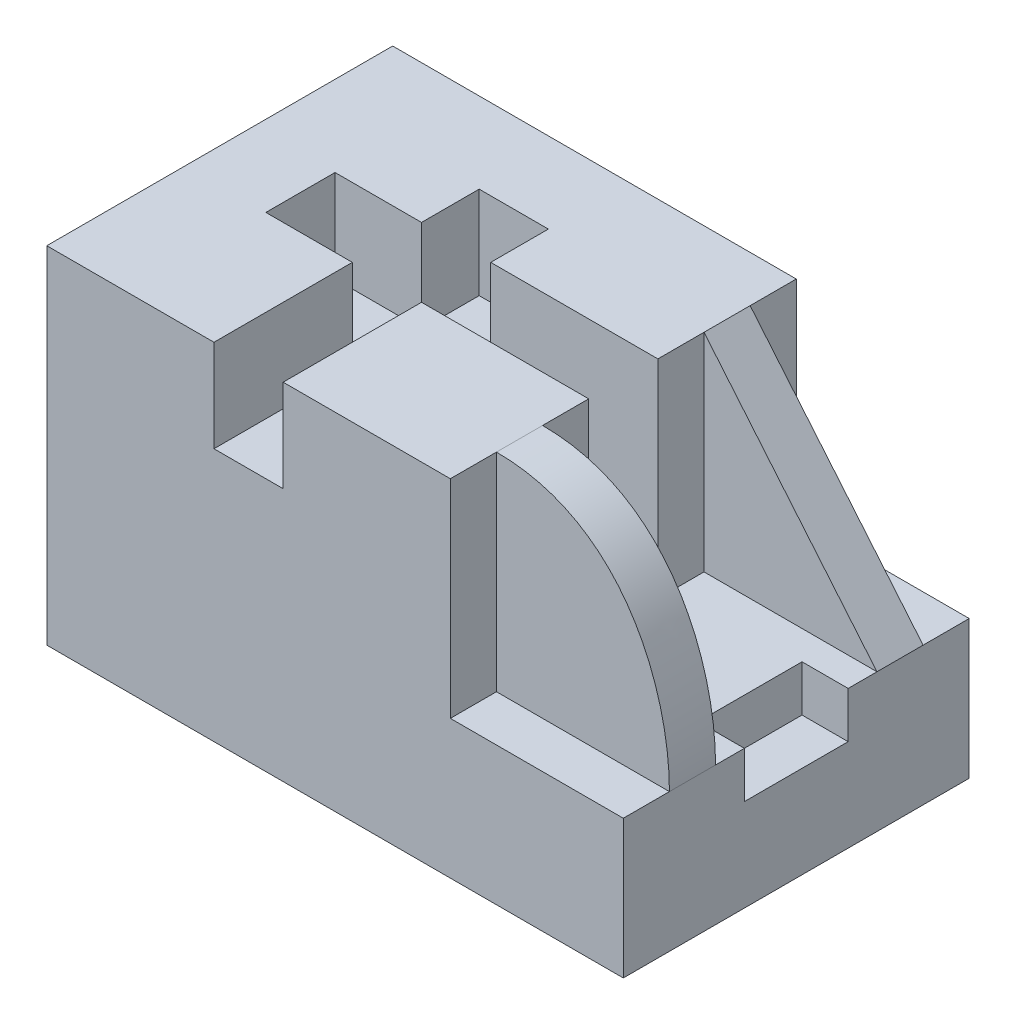
from build123d import *

# Parameters (mm, degrees)
SKETCH_1_W          = 50
SKETCH_1_H          = 30
EXTRUDE_1_DEPTH     = 30
SKETCH_2_W          = 15
SKETCH_2_H          = 18
CUT_EXTRUDE_1_DEPTH = 42.833001327
SKETCH_3_W          = 14.5
SKETCH_3_H          = 6
CUT_EXTRUDE_2_DEPTH = 18
SKETCH_3_3_W        = 6
SKETCH_3_3_H        = 12
SKETCH_3_3_H_2      = 6
SKETCH_3_3_H_3      = 5
SKETCH_3_3_W_2      = 7.5
CUT_EXTRUDE_3_DEPTH = 8
RIB_START           = -2
RIB_1_DEPTH         = 4
RIB_2_REACH         = 39.762
SKETCH_5_WALL_W     = 100.955579594
SKETCH_5_WALL_H     = 4
SKETCH_6_W          = 4
SKETCH_6_H          = 9
CUT_EXTRUDE_4_DEPTH = 4


# Read off the part's stored shape, not the designer's step: Ребро1
with BuildPart() as part:
    # Эскиз1 → Бобышка-Вытянуть1 (new body)
    with BuildSketch(Plane.XY):
        Rectangle(SKETCH_1_W, SKETCH_1_H)
    extrude(amount=EXTRUDE_1_DEPTH)

    # Эскиз2 → Вырез-Вытянуть1 (cut, through all)
    with BuildSketch(Plane.XY.offset(30)):
        with Locations((17.5, 6)):
            Rectangle(SKETCH_2_W, SKETCH_2_H)
    extrude(amount=-CUT_EXTRUDE_1_DEPTH, mode=Mode.SUBTRACT)

    # Эскиз3 → Вырез-Вытянуть2 (cut)
    with BuildSketch(Plane(origin=(0, 15, 0), x_dir=(1, 0, 0), z_dir=(0, 1, 0))):
        with Locations((2.75, -15)):
            Rectangle(SKETCH_3_W, SKETCH_3_H)
    extrude(amount=-CUT_EXTRUDE_2_DEPTH, mode=Mode.SUBTRACT)

    # Эскиз3<3> → Вырез-Вытянуть3 (cut)
    with BuildSketch(Plane(origin=(0, 15, 0), x_dir=(1, 0, 0), z_dir=(0, 1, 0))):
        with Locations((-7.5, -24)):
            Rectangle(SKETCH_3_3_W, SKETCH_3_3_H)
        with Locations((-7.5, -15)):
            Rectangle(SKETCH_3_3_W, SKETCH_3_3_H_2)
        with Locations((-7.5, -9.5)):
            Rectangle(SKETCH_3_3_W, SKETCH_3_3_H_3)
        with Locations((-14.25, -15)):
            Rectangle(SKETCH_3_3_W_2, SKETCH_3_3_H_2)
    extrude(amount=-CUT_EXTRUDE_3_DEPTH, mode=Mode.SUBTRACT)

    # Ребро1 outline → Ребро1 (add)
    with BuildSketch(Plane.XY.offset(24).offset(RIB_START)):
        with BuildLine():
            add(Edge.make_bspline(
                [(10, 15), (20.842232601, 15), (25, 4.810249676), (25, -3)],
                knots=[0, 0, 0, 0, 1, 1, 1, 1], degree=3))
            Line((10, 15), (10, -3))
            Line((10, -3), (25, -3))
        make_face()
    extrude(amount=RIB_1_DEPTH)

    # Эскиз5 wall → Ребро2 (add, up to next)
    with BuildSketch(Plane(origin=(17.5, 6, 6), x_dir=(-0.640184399664, 0.768221279597, 0), z_dir=(-0.768221279597, -0.640184399664, 0)), mode=Mode.PRIVATE) as rib_2_sk1:
        Rectangle(SKETCH_5_WALL_W, SKETCH_5_WALL_H)
    rib_2_tool1 = extrude(rib_2_sk1.sketch, amount=RIB_2_REACH, mode=Mode.PRIVATE) - part.part
    add(rib_2_tool1.solids().sort_by_distance((17.5, 6, 6))[0])

    # Эскиз6 → Вырез-Вытянуть4 (cut)
    with BuildSketch(Plane(origin=(0, -3, 0), x_dir=(1, 0, 0), z_dir=(0, 1, 0))):
        with Locations((23, -15)):
            Rectangle(SKETCH_6_W, SKETCH_6_H)
    extrude(amount=-CUT_EXTRUDE_4_DEPTH, mode=Mode.SUBTRACT)


solid = part.part
